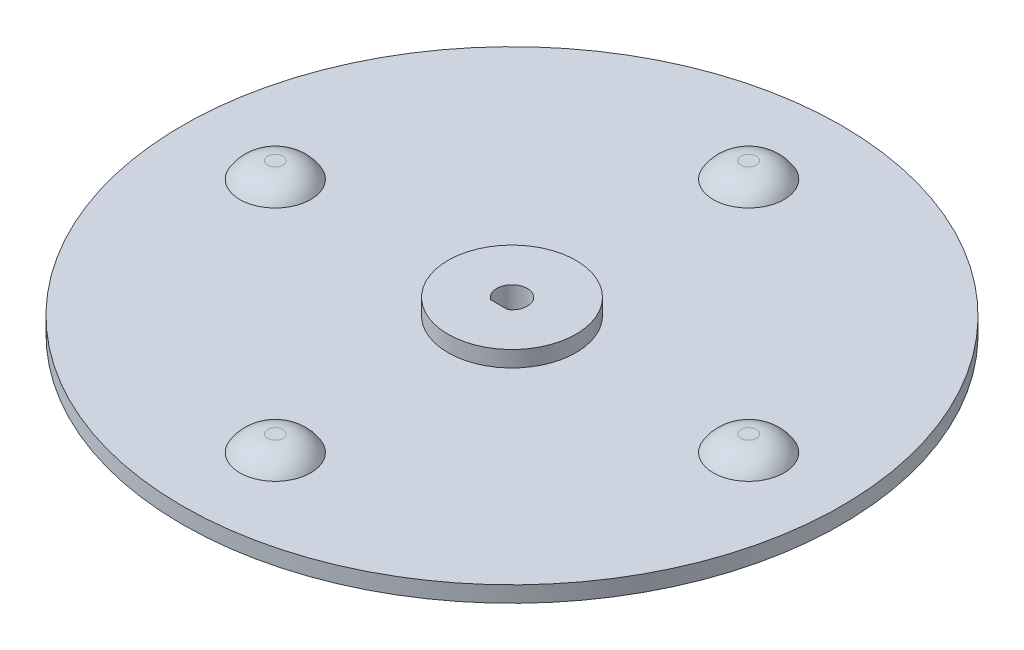
from build123d import *

# Parameters (mm, degrees)
SKETCH1_R           = 65.405
BOSS_EXTRUDE1_DEPTH = 3.175
SKETCH2_R           = 12.7
BOSS_EXTRUDE2_DEPTH = 3.175
CUT_EXTRUDE1_DEPTH  = 5.842
SKETCH4_R           = 7.032250482
BOSS_EXTRUDE3_DEPTH = 3.175
FILLET3_R           = 6.35


with BuildPart() as part:
    # Sketch1 → Boss-Extrude1 (new body)
    with BuildSketch(Plane(origin=(0, 0, 0), x_dir=(1, 0, 0), z_dir=(0, 1, 0))):
        with Locations(Location((0, 0, 0), (0, 0, 270))):
            Circle(SKETCH1_R)
    extrude(amount=BOSS_EXTRUDE1_DEPTH)

    # Sketch2 → Boss-Extrude2 (add)
    with BuildSketch(Plane(origin=(0, 3.175, 0), x_dir=(1, 0, 0), z_dir=(0, 1, 0))):
        with Locations(Location((0, 0, 0), (0, 0, 270))):
            Circle(SKETCH2_R)
    extrude(amount=BOSS_EXTRUDE2_DEPTH)

    # Sketch3 → Cut-Extrude1 (cut)
    with BuildSketch(Plane(origin=(0, 6.35, 0), x_dir=(1, 0, 0), z_dir=(0, 1, 0))):
        with BuildLine():
            Line((-1.684845394, -2.54), (1.684845394, -2.54))
            ThreePointArc((1.684845394, -2.54), (0, 3.048), (-1.684845394, -2.54))
        make_face()
    extrude(amount=-CUT_EXTRUDE1_DEPTH, mode=Mode.SUBTRACT)

    # Sketch4 → Boss-Extrude3 (add)
    with BuildSketch(Plane(origin=(0, 3.175, 0), x_dir=(1, 0, 0), z_dir=(0, 1, 0))):
        with Locations(Location((0, 46.973149897, 0), (0, 0, 270))):
            Circle(SKETCH4_R)
        with Locations(Location((46.973149897, 0, 0), (0, 0, 270))):
            Circle(SKETCH4_R)
        with Locations(Location((0, -46.973149897, 0), (0, 0, 270))):
            Circle(SKETCH4_R)
        with Locations(Location((-46.973149897, 0, 0), (0, 0, 270))):
            Circle(SKETCH4_R)
    extrude(amount=BOSS_EXTRUDE3_DEPTH)

    # Fillet3
    # the kernel refuses this fillet: 6.35 mm, written as the material it takes off along each edge
    with BuildSketch(Plane(origin=(0, 6.35, -46.973149897), x_dir=(0, 0, 1), z_dir=(-1, 0, 0))) as fillet3_piece_1:
        with BuildLine():
            CenterArc((1.532989168, -6.35), FILLET3_R, 30, 60)
            Line((1.532989168, 0), (1.532989168, 0.127))
            Line((1.532989168, 0.127), (7.032250482, 0.127))
            Line((7.032250482, 0.127), (7.159250482, 0))
            ThreePointArc((7.159250482, 0), (7.159250482, -1.5875), (7.142235708, -3.1115))
            Line((7.142235708, -3.1115), (7.032250482, -3.175))
        make_face()
    revolve(axis=Axis((0, 6.35, -46.973149897), (0, 1, 0)), mode=Mode.SUBTRACT)
    with BuildSketch(Plane(origin=(46.973149897, 6.35, 0), x_dir=(0, 0, 1), z_dir=(-1, 0, 0))) as fillet3_piece_2:
        with BuildLine():
            CenterArc((1.532989168, -6.35), FILLET3_R, 30, 60)
            Line((1.532989168, 0), (1.532989168, 0.127))
            Line((1.532989168, 0.127), (7.032250482, 0.127))
            Line((7.032250482, 0.127), (7.159250482, 0))
            ThreePointArc((7.159250482, 0), (7.159250482, -1.5875), (7.142235708, -3.1115))
            Line((7.142235708, -3.1115), (7.032250482, -3.175))
        make_face()
    revolve(axis=Axis((46.973149897, 6.35, 0), (0, 1, 0)), mode=Mode.SUBTRACT)
    with BuildSketch(Plane(origin=(0, 6.35, 46.973149897), x_dir=(0, 0, 1), z_dir=(-1, 0, 0))) as fillet3_piece_3:
        with BuildLine():
            CenterArc((1.532989168, -6.35), FILLET3_R, 30, 60)
            Line((1.532989168, 0), (1.532989168, 0.127))
            Line((1.532989168, 0.127), (7.032250482, 0.127))
            Line((7.032250482, 0.127), (7.159250482, 0))
            ThreePointArc((7.159250482, 0), (7.159250482, -1.5875), (7.142235708, -3.1115))
            Line((7.142235708, -3.1115), (7.032250482, -3.175))
        make_face()
    revolve(axis=Axis((0, 6.35, 46.973149897), (0, 1, 0)), mode=Mode.SUBTRACT)
    with BuildSketch(Plane(origin=(-46.973149897, 6.35, 0), x_dir=(0, 0, 1), z_dir=(-1, 0, 0))) as fillet3_piece_4:
        with BuildLine():
            CenterArc((1.532989168, -6.35), FILLET3_R, 30, 60)
            Line((1.532989168, 0), (1.532989168, 0.127))
            Line((1.532989168, 0.127), (7.032250482, 0.127))
            Line((7.032250482, 0.127), (7.159250482, 0))
            ThreePointArc((7.159250482, 0), (7.159250482, -1.5875), (7.142235708, -3.1115))
            Line((7.142235708, -3.1115), (7.032250482, -3.175))
        make_face()
    revolve(axis=Axis((-46.973149897, 6.35, 0), (0, 1, 0)), mode=Mode.SUBTRACT)


solid = part.part
